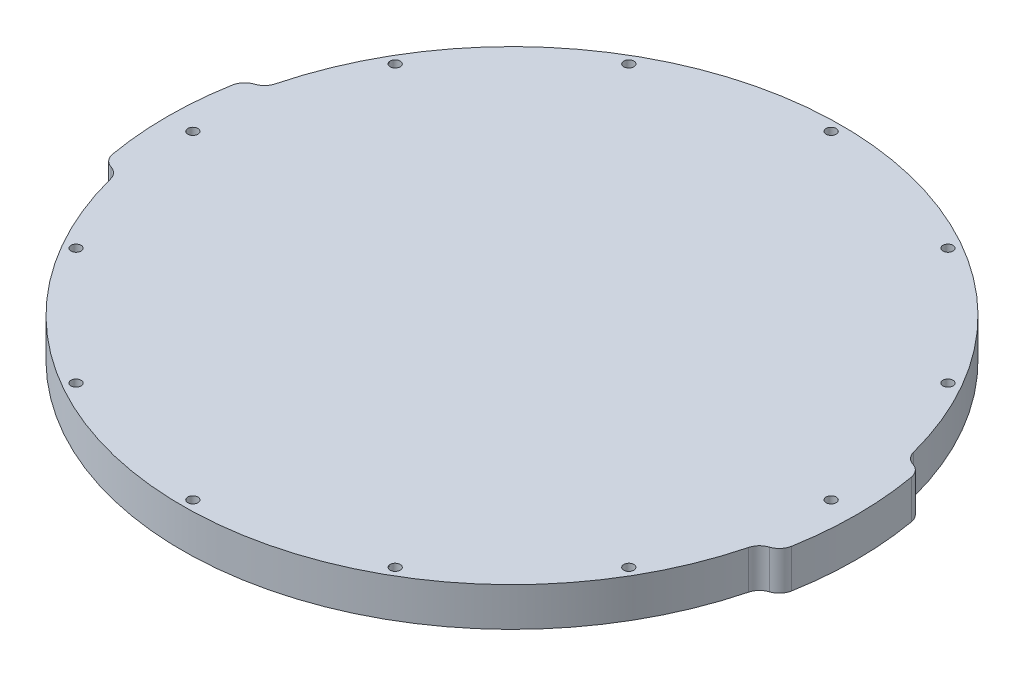
from build123d import *

# Parameters (mm, degrees)
SKETCH1_R           = 1.65
BOSS_EXTRUDE1_DEPTH = 12.7
FILLET1_R           = 5


with BuildPart() as part:
    # Sketch1 → Boss-Extrude1 (new body)
    with BuildSketch(Plane(origin=(0, 0, 0), x_dir=(1, 0, 0), z_dir=(0, 1, 0))):
        with BuildLine():
            ThreePointArc((-111.234035703, -19.613561667), (-112.95, 0), (-111.234035703, 19.613561667))
            ThreePointArc((-111.234035703, 19.613561667), (-109.13025705, 22.87401705), (-105.327953741, 23.647931427))
            ThreePointArc((-105.327953741, 23.647931427), (0, 107.95), (105.327953741, 23.647931427))
            ThreePointArc((105.327953741, 23.647931427), (109.13025705, 22.87401705), (111.234035703, 19.613561667))
            ThreePointArc((111.234035703, 19.613561667), (112.95, 0), (111.234035703, -19.613561667))
            ThreePointArc((111.234035703, -19.613561667), (109.13025705, -22.87401705), (105.327953741, -23.647931427))
            ThreePointArc((105.327953741, -23.647931427), (0, -107.95), (-105.327953741, -23.647931427))
            ThreePointArc((-105.327953741, -23.647931427), (-109.13025705, -22.87401705), (-111.234035703, -19.613561667))
        make_face()
        with Locations((0, 104.55)):
            Circle(SKETCH1_R, mode=Mode.SUBTRACT)
        with Locations((52.275, 90.542955966)):
            Circle(SKETCH1_R, mode=Mode.SUBTRACT)
        with Locations((90.542955966, 52.275)):
            Circle(SKETCH1_R, mode=Mode.SUBTRACT)
        with Locations((104.55, 0)):
            Circle(SKETCH1_R, mode=Mode.SUBTRACT)
        with Locations((90.542955966, -52.275)):
            Circle(SKETCH1_R, mode=Mode.SUBTRACT)
        with Locations((52.275, -90.542955966)):
            Circle(SKETCH1_R, mode=Mode.SUBTRACT)
        with Locations((0, -104.55)):
            Circle(SKETCH1_R, mode=Mode.SUBTRACT)
        with Locations((-52.275, -90.542955966)):
            Circle(SKETCH1_R, mode=Mode.SUBTRACT)
        with Locations((-90.542955966, -52.275)):
            Circle(SKETCH1_R, mode=Mode.SUBTRACT)
        with Locations((-104.55, 0)):
            Circle(SKETCH1_R, mode=Mode.SUBTRACT)
        with Locations((-90.542955966, 52.275)):
            Circle(SKETCH1_R, mode=Mode.SUBTRACT)
        with Locations((-52.275, 90.542955966)):
            Circle(SKETCH1_R, mode=Mode.SUBTRACT)
    extrude(amount=BOSS_EXTRUDE1_DEPTH)

    # Fillet1
    fillet1_edges = [part.edges().sort_by_distance(p)[0] for p in [
        (105.327953741, 6.35, 23.647931427),
        (105.327953741, 6.35, -23.647931427),
        (-105.327953741, 6.35, -23.647931427),
        (-105.327953741, 6.35, 23.647931427),
    ]]
    fillet(fillet1_edges, radius=FILLET1_R)


solid = part.part
